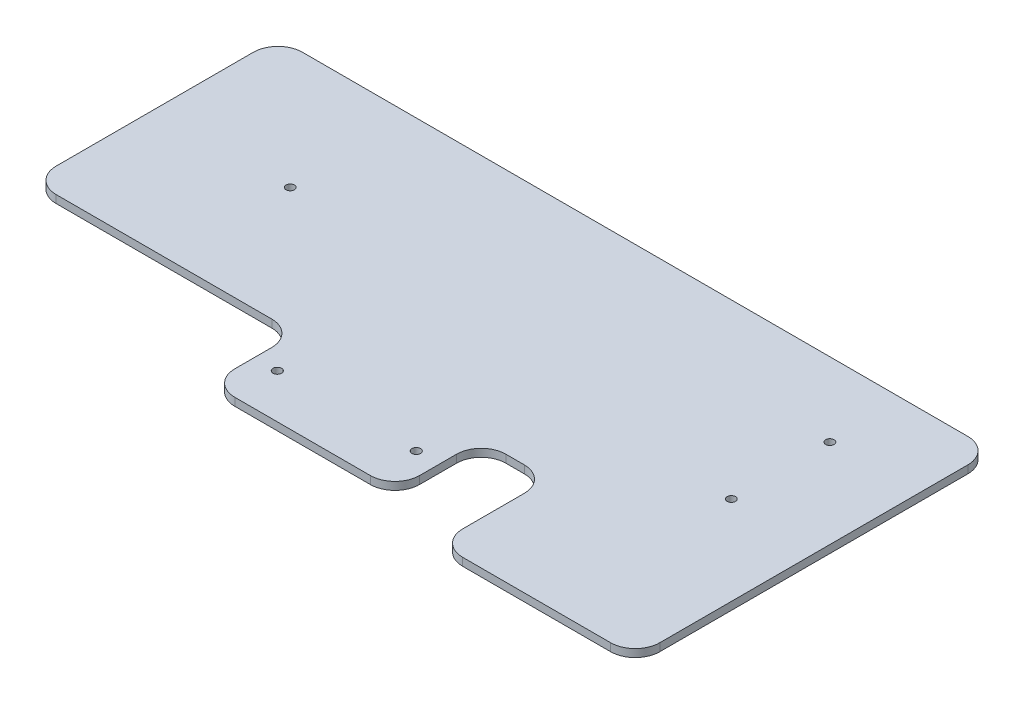
from build123d import *

# Parameters (mm, degrees)
SKETCH1_R           = 1.75
BOSS_EXTRUDE1_DEPTH = 3.175
FILLET1_R           = 10
STANDOFF_HOLES_D    = 3.4


with BuildPart() as part:
    # Sketch1 → Boss-Extrude1 (new body)
    with BuildSketch(Plane(origin=(0, 0, 0), x_dir=(1, 0, 0), z_dir=(0, 1, 0))):
        Polygon((65, -50), (37.5, -50), (37.5, -85), (-37.5, -85), (-37.5, -50), (-145, -50), (-145, 50), (145, 50), (145, -50), (145, -95), (65, -95), align=None)
        with Locations((28.194, -67.06)):
            Circle(SKETCH1_R, mode=Mode.SUBTRACT)
        with Locations((-28.194, -67.06)):
            Circle(SKETCH1_R, mode=Mode.SUBTRACT)
    extrude(amount=BOSS_EXTRUDE1_DEPTH)

    # Fillet1
    fillet1_edges = [part.edges().sort_by_distance(p)[0] for p in [
        (145, 1.5875, -50),
        (145, 1.5875, 95),
        (65, 1.5875, 95),
        (65, 1.5875, 50),
        (-145, 1.5875, -50),
        (37.5, 1.5875, 85),
        (-37.5, 1.5875, 85),
        (-37.5, 1.5875, 50),
        (-145, 1.5875, 50),
        (37.5, 1.5875, 50),
    ]]
    fillet(fillet1_edges, radius=FILLET1_R)

    # standoff holes (through all)
    with Locations(Plane(origin=(0, 3.175, 0), x_dir=(1, 0, 0), z_dir=(0, 1, 0))):
        with Locations((-90, 0), (109, 20), (109, -20)):
            Hole(STANDOFF_HOLES_D / 2)


solid = part.part
